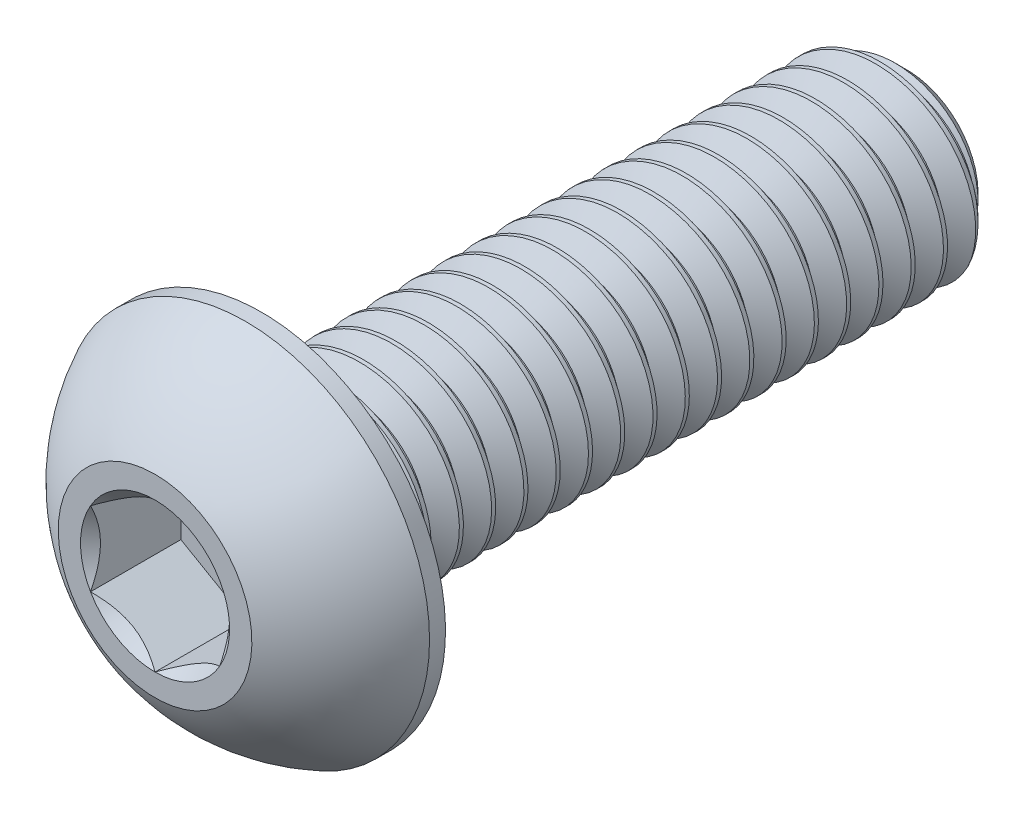
from build123d import *

# Parameters (mm, degrees)
CUT_EXTRUDE1_DEPTH = 1.4
CUT_SWEEP1_PITCH   = 0.5
CUT_SWEEP1_TO      = 10


with BuildPart() as part:
    # Sketch2 → Revolve1 (revolve)
    with BuildSketch(Plane(origin=(0, 0, 0), x_dir=(0, 0, -1), z_dir=(1, 0, 0)), mode=Mode.PRIVATE) as revolve1_sk:
        with BuildLine():
            Line((-5.825, 0), (5.825, 0))
            Line((5.825, 0), (5.825, 1.1))
            Line((5.825, 1.1), (5.425, 1.5))
            Line((5.425, 1.5), (-4.175, 1.5))
            Line((-4.175, 1.5), (-4.175, 2.85))
            Line((-4.175, 2.85), (-4.4225, 2.85))
            ThreePointArc((-4.4225, 2.85), (-5.22987489, 2.285251969), (-5.825, 1.5))
            Line((-5.825, 1.5), (-5.825, 0))
        make_face()
    revolve(revolve1_sk.sketch.rotate(Axis((0, 0, 5.825), (0, 0, -1)), 180), axis=Axis((0, 0, 5.825), (0, 0, -1)))

    # Sketch3 → Cut-Extrude1 (cut)
    with BuildSketch(Plane.XY.offset(5.825)):
        Polygon((0, 1.154700538), (-1, 0.577350269), (-1, -0.577350269), (0, -1.154700538), (1, -0.577350269), (1, 0.577350269), align=None)
    extrude(amount=-CUT_EXTRUDE1_DEPTH, mode=Mode.SUBTRACT)

    # Cut-Extrude2 cone 1 section (through the dimple's axis) → Cut-Extrude2 (revolve, cut)
    with BuildSketch(Plane(origin=(0, 0, 5.825), x_dir=(0, -1, 0), z_dir=(1, 0, 0))):
        Polygon((0, 0), (1.154700538, 0), (0, 1.154700538), align=None)
    revolve(axis=Axis((0, 0, 5.825), (0, 0, -1)), mode=Mode.SUBTRACT)


with BuildPart() as body_2:
    # Split1: read off the stored shape, not the designer's step
    # Split1: the piece on the far side of the plane
    add(part.part)
    split(bisect_by=Plane.XY.offset(4.175), keep=Keep.BOTTOM)

    # Cut-Sweep1: arcs per turn and ends read off the stored shape
    # Cut-Sweep1: the profile of Sketch6 screwed along a right-hand helix through 21 turns, 6 arcs to a turn; built about Z, then put on its axis
    cut_sweep1_z = Axis((0, 0, 0), (0, 0, 1))
    cut_sweep1_corners = [(1.175240474, 0, -0.1875), (1.175240474, 0, -0.25), (1.527063294, 0, -0.453125), (1.527063294, 0, 0.015625)]
    with BuildLine(mode=Mode.PRIVATE) as cut_sweep1_profile:
        Line(cut_sweep1_corners[0], cut_sweep1_corners[1])
        Line(cut_sweep1_corners[1], cut_sweep1_corners[2])
        Line(cut_sweep1_corners[2], cut_sweep1_corners[3])
        Line(cut_sweep1_corners[3], cut_sweep1_corners[0])
    cut_sweep1_cap = Face(cut_sweep1_profile.wire())
    cut_sweep1_turn_angles = [0, 30, 60, 90, 120, 150, 180, 210, 240, 270, 300, 330, 360]
    cut_sweep1_turn_weights = [1, 0.8660254037844387, 1, 0.8660254037844387, 1, 0.8660254037844387, 1, 0.8660254037844387, 1, 0.8660254037844387, 1, 0.8660254037844387, 1]
    cut_sweep1_turn_rails = [Edge.make_bspline([Vector(p[0], p[1], 0).rotate(cut_sweep1_z, cut_sweep1_turn_angles[k]) / cut_sweep1_turn_weights[k] + Vector(0, 0, p[2] + CUT_SWEEP1_PITCH * cut_sweep1_turn_angles[k] / 360) for k in range(13)], [0, 0, 0, 1, 1, 2, 2, 3, 3, 4, 4, 5, 5, 6, 6, 6], 2, cut_sweep1_turn_weights) for p in cut_sweep1_corners]
    cut_sweep1_turn_sides = [Face.make_surface_from_curves(cut_sweep1_turn_rails[p[0]], cut_sweep1_turn_rails[p[1]]) for p in [(0, 1), (1, 2), (2, 3), (3, 0)]]
    cut_sweep1 = Plane(origin=(0, 0, -5.825), x_dir=(0, 1, 0), z_dir=(0, 0, 1)) * split(Solid(Shell([*[p.moved(Location((0, 0, CUT_SWEEP1_PITCH * i))) for i in range(21) for p in cut_sweep1_turn_sides], cut_sweep1_cap, cut_sweep1_cap.rotate(cut_sweep1_z, 7560).moved(Location((0, 0, CUT_SWEEP1_PITCH * 7560 / 360)))])), bisect_by=Plane.XY.offset(CUT_SWEEP1_TO), keep=Keep.BOTTOM, mode=Mode.PRIVATE)
    add(cut_sweep1, mode=Mode.SUBTRACT)


with BuildPart() as part_1:
    add(part.part)

    # Split1
    split(bisect_by=Plane.XY.offset(4.175), keep=Keep.TOP)

    add(body_2.part)  # Boss-Extrude1 merges body 2
    # Boss-Extrude1: read off the stored shape, not the designer's step
    # Boss-Extrude1 outline → Boss-Extrude1 (revolve)
    with BuildSketch(Plane.XZ):
        Polygon((1.175239268, 4.175), (1.175239268, 3.612497912), (1.5, 4.175), align=None)
    revolve(axis=Axis((0, 0, 0), (0, 0, 1)))


solid = part_1.part
